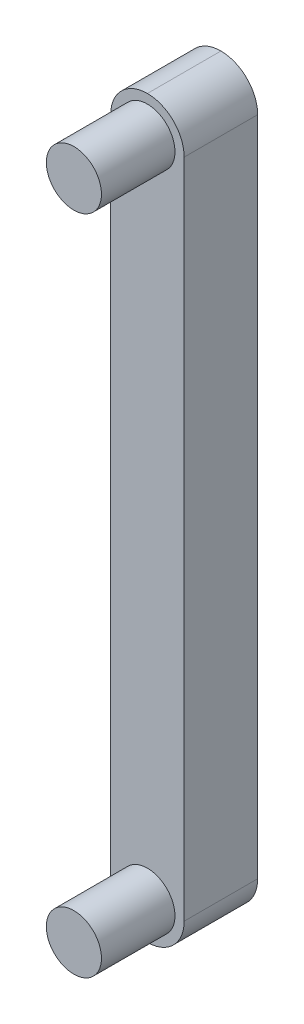
from build123d import *

# Parameters (mm, degrees)
SKETCH1_W           = 20
SKETCH1_H           = 200
BOSS_EXTRUDE1_DEPTH = 20
FILLET1_R           = 10
FILLET2_R           = 10
FILLET3_R           = 10
FILLET4_R           = 10
SCALE1_SCALE        = 0.8
SKETCH2_R           = 6
BOSS_EXTRUDE3_DEPTH = 16


with BuildPart() as part:
    # Sketch1 → Boss-Extrude1 (new body)
    with BuildSketch(Plane.XY):
        with Locations((10, 100)):
            Rectangle(SKETCH1_W, SKETCH1_H)
    extrude(amount=BOSS_EXTRUDE1_DEPTH)

    # Fillet1
    fillet1_edges = [part.edges().sort_by_distance(p)[0] for p in [
        (20, 200, 10),
    ]]
    fillet(fillet1_edges, radius=FILLET1_R)

    # Fillet2
    fillet2_edges = [part.edges().sort_by_distance(p)[0] for p in [
        (0, 200, 10),
    ]]
    fillet(fillet2_edges, radius=FILLET2_R - 0.0001)  # a hair under: the kernel refuses the full size

    # Fillet3
    fillet3_edges = [part.edges().sort_by_distance(p)[0] for p in [
        (0, 0, 10),
    ]]
    fillet(fillet3_edges, radius=FILLET3_R)

    # Fillet4
    fillet4_edges = [part.edges().sort_by_distance(p)[0] for p in [
        (20, 0, 10),
    ]]
    fillet(fillet4_edges, radius=FILLET4_R - 0.0001)  # a hair under: the kernel refuses the full size


with BuildPart() as part_1:
    # Scale1: scaled about (10, 100, 10)
    add(part.part.scale(SCALE1_SCALE).moved(Location((2, 20, 2))))

    # Sketch2 → Boss-Extrude3 (add)
    with BuildSketch(Plane.XY.offset(18)):
        with Locations(Location((10, 172, 0), (0, 0, 180))):
            Circle(SKETCH2_R)
        with Locations(Location((10, 28, 0), (0, 0, 180))):
            Circle(SKETCH2_R)
    extrude(amount=BOSS_EXTRUDE3_DEPTH)


solid = part_1.part
